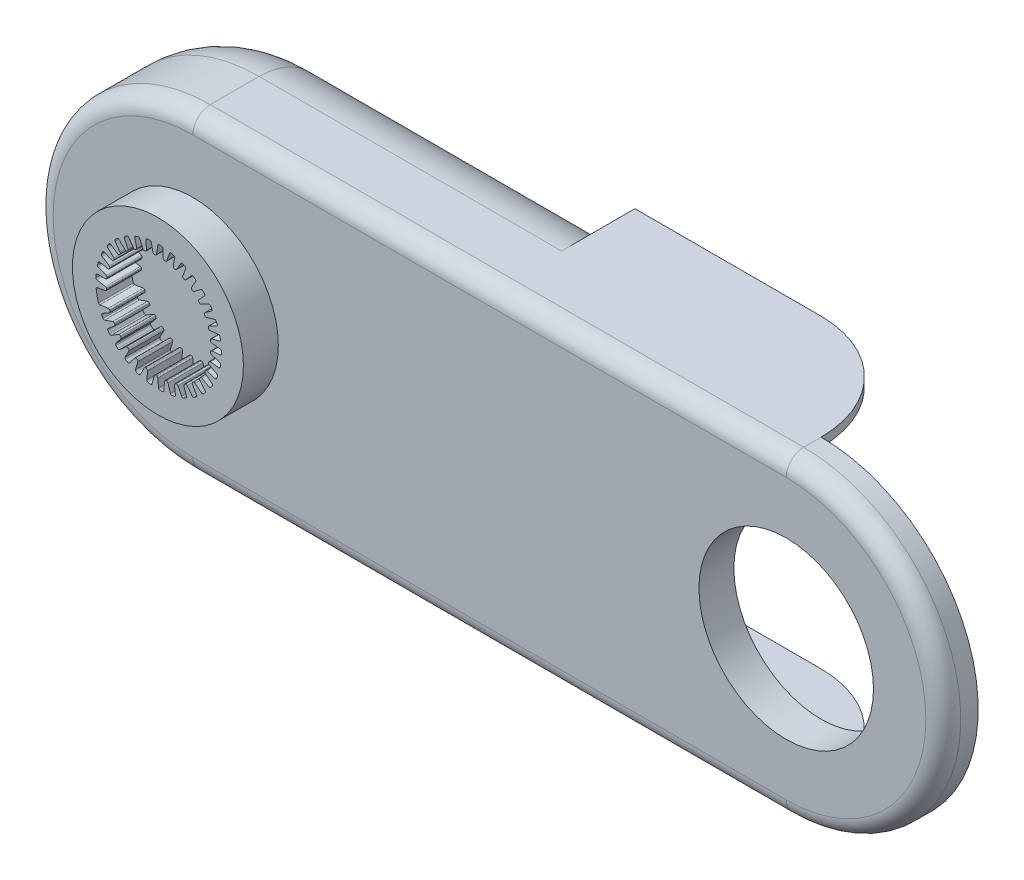
from build123d import *

# Parameters (mm, degrees)
SKETCH1_R           = 24.5
BOSS_EXTRUDE1_DEPTH = 10
BOSS_EXTRUDE3_DEPTH = 40
CUT_EXTRUDE3_DEPTH  = 30
FILLET12_R          = 5
FILLET14_R          = 30
SKETCH8_W           = 148.27581146
SKETCH8_H           = 90
CUT_EXTRUDE4_DEPTH  = 1
FILLET16_R          = 20
SKETCH9_R           = 25
CUT_EXTRUDE5_DEPTH  = 222.337274565
SCALE1_SCALE        = 0.3


with BuildPart() as part:
    # Sketch1 → Boss-Extrude1 (new body)
    with BuildSketch(Plane.XY):
        with Locations((-0.371975008, 0)):
            Circle(SKETCH1_R)
        with BuildLine():
            Line((-16.969142825, -5.497864624), (-14.564977721, -5.124585631))
            ThreePointArc((-14.564977721, -5.124585631), (-14.29707046, -5.177296982), (-14.125400218, -5.389622476))
            Line((-14.125400218, -5.389622476), (-14.049847687, -5.60904296))
            ThreePointArc((-14.049847687, -5.60904296), (-14.054138659, -5.881349365), (-14.231761388, -6.087793926))
            Line((-14.231761388, -6.087793926), (-16.278130424, -7.240339372))
            ThreePointArc((-16.278130424, -7.240339372), (-16.462911631, -7.467282264), (-16.443705401, -7.759306734))
            ThreePointArc((-16.443705401, -7.759306734), (-16.284490349, -8.088614134), (-16.11861668, -8.414618309))
            ThreePointArc((-16.11861668, -8.414618309), (-15.909353928, -8.602256969), (-15.62830969, -8.605904202))
            Line((-15.62830969, -8.605904202), (-13.33954086, -7.780747067))
            ThreePointArc((-13.33954086, -7.780747067), (-13.06649801, -7.781370848), (-12.857468219, -7.957039097))
            Line((-12.857468219, -7.957039097), (-12.741436398, -8.158012106))
            ThreePointArc((-12.741436398, -8.158012106), (-12.693690022, -8.426134232), (-12.828657842, -8.662677839))
            Line((-12.828657842, -8.662677839), (-14.617513276, -10.1845134))
            ThreePointArc((-14.617513276, -10.1845134), (-14.755596786, -10.442544627), (-14.681022533, -10.725539064))
            ThreePointArc((-14.681022533, -10.725539064), (-14.461897897, -11.018416496), (-14.236867265, -11.306780868))
            ThreePointArc((-14.236867265, -11.306780868), (-13.995646114, -11.451042861), (-13.719069526, -11.400997316))
            Line((-13.719069526, -11.400997316), (-11.62979923, -10.15428296))
            ThreePointArc((-11.62979923, -10.15428296), (-11.361653923, -10.102796248), (-11.122945516, -10.235352213))
            Line((-11.122945516, -10.235352213), (-10.970698069, -10.410492867))
            ThreePointArc((-10.970698069, -10.410492867), (-10.872668815, -10.664578395), (-10.960022248, -10.922529105))
            Line((-10.960022248, -10.922529105), (-12.425631454, -12.757733968))
            ThreePointArc((-12.425631454, -12.757733968), (-12.511943302, -13.037372011), (-12.384741304, -13.300937604))
            ThreePointArc((-12.384741304, -13.300937604), (-12.113758956, -13.546623101), (-11.837840254, -13.786751538))
            ThreePointArc((-11.837840254, -13.786751538), (-11.57352453, -13.882335867), (-11.311578572, -13.780436499))
            Line((-11.311578572, -13.780436499), (-9.49857837, -12.157976231))
            ThreePointArc((-9.49857837, -12.157976231), (-9.245183775, -12.056270938), (-8.985568244, -12.140843765))
            Line((-8.985568244, -12.140843765), (-8.802699599, -12.28371641))
            ThreePointArc((-8.802699599, -12.28371641), (-8.657989614, -12.514428808), (-8.694518802, -12.784308057))
            Line((-8.694518802, -12.784308057), (-9.783027044, -14.865446458))
            ThreePointArc((-9.783027044, -14.865446458), (-9.814395646, -15.15641584), (-9.63924002, -15.390867705))
            ThreePointArc((-9.63924002, -15.390867705), (-9.326357378, -15.580333398), (-9.009689414, -15.763402229))
            ThreePointArc((-9.009689414, -15.763402229), (-8.731991565, -15.806796587), (-8.494301608, -15.656787752))
            Line((-8.494301608, -15.656787752), (-7.02419134, -13.718199902))
            ThreePointArc((-7.02419134, -13.718199902), (-6.794858602, -13.570013254), (-6.523875683, -13.603495261))
            Line((-6.523875683, -13.603495261), (-6.317105464, -13.70884995))
            ThreePointArc((-6.317105464, -13.70884995), (-6.131032208, -13.907711545), (-6.115394864, -14.179602449))
            Line((-6.115394864, -14.179602449), (-6.786804216, -16.430201641))
            ThreePointArc((-6.786804216, -16.430201641), (-6.762076913, -16.721810507), (-6.545403865, -16.918533562))
            ThreePointArc((-6.545403865, -16.918533562), (-6.202118, -17.044817414), (-5.856336939, -17.164099659))
            ThreePointArc((-5.856336939, -17.164099659), (-5.575461147, -17.153709492), (-5.370761259, -16.96110336))
            Line((-5.370761259, -16.96110336), (-4.297561057, -14.777622566))
            ThreePointArc((-4.297561057, -14.777622566), (-4.100717154, -14.588399775), (-3.828324286, -14.569560645))
            Line((-3.828324286, -14.569560645), (-3.605250396, -14.633526053))
            ThreePointArc((-3.605250396, -14.633526053), (-3.384651249, -14.79322955), (-3.317421976, -15.057141307))
            Line((-3.317421976, -15.057141307), (-3.547061077, -17.394501596))
            ThreePointArc((-3.547061077, -17.394501596), (-3.467146489, -17.676034594), (-3.216917807, -17.827800126))
            ThreePointArc((-3.216917807, -17.827800126), (-2.855842975, -17.886261756), (-2.49365476, -17.937374314))
            ThreePointArc((-2.49365476, -17.937374314), (-2.219921985, -17.873581416), (-2.055733994, -17.645455421))
            Line((-2.055733994, -17.645455421), (-1.418879279, -15.297315067))
            ThreePointArc((-1.418879279, -15.297315067), (-1.261757363, -15.074009244), (-0.997963795, -15.003541232))
            Line((-0.997963795, -15.003541232), (-0.766783225, -15.023766911))
            ThreePointArc((-0.766783225, -15.023766911), (-0.519764242, -15.138443903), (-0.403413423, -15.384678908))
            Line((-0.403413423, -15.384678908), (-0.182844038, -17.722912511))
            ThreePointArc((-0.182844038, -17.722912511), (-0.050678678, -17.984024533), (0.223910828, -18.085255821))
            ThreePointArc((0.223910828, -18.085255821), (0.589506703, -18.073747021), (0.954793236, -18.054811727))
            ThreePointArc((0.954793236, -18.054811727), (1.21132451, -17.939960209), (1.328967414, -17.684696986))
            Line((1.328967414, -17.684696986), (1.506075012, -15.258180974))
            ThreePointArc((1.506075012, -15.258180974), (1.617701396, -15.008997633), (1.863202402, -14.889490132))
            Line((1.863202402, -14.889490132), (2.093994776, -14.865232876))
            ThreePointArc((2.093994776, -14.865232876), (2.358356726, -14.930669484), (2.519553706, -15.150179676))
            Line((2.519553706, -15.150179676), (3.182226615, -17.403366719))
            ThreePointArc((3.182226615, -17.403366719), (3.361786248, -17.634463038), (3.650646611, -17.681440275))
            ThreePointArc((3.650646611, -17.681440275), (4.007329478, -17.600383942), (4.362291644, -17.512096587))
            ThreePointArc((4.362291644, -17.512096587), (4.592195013, -17.35040674), (4.658969966, -17.077386096))
            Line((4.658969966, -17.077386096), (4.369822517, -14.661658296))
            ThreePointArc((4.369822517, -14.661658296), (4.431851587, -14.395753836), (4.650038942, -14.231598224))
            Line((4.650038942, -14.231598224), (4.871962507, -14.163749381))
            ThreePointArc((4.871962507, -14.163749381), (5.143953277, -14.177541097), (5.344073133, -14.362260434))
            Line((5.344073133, -14.362260434), (6.424499231, -16.447606133))
            ThreePointArc((6.424499231, -16.447606133), (6.644855104, -16.640194968), (6.937371968, -16.631191945))
            ThreePointArc((6.937371968, -16.631191945), (7.272035289, -16.483566546), (7.603629778, -16.329171304))
            ThreePointArc((7.603629778, -16.329171304), (7.798457298, -16.126584524), (7.811910612, -15.845838777))
            Line((7.811910612, -15.845838777), (7.067133021, -13.529666635))
            ThreePointArc((7.067133021, -13.529666635), (7.077285479, -13.256811885), (7.260141751, -13.054040163))
            Line((7.260141751, -13.054040163), (7.465041785, -12.945092882))
            ThreePointArc((7.465041785, -12.945092882), (7.734666902, -12.906732919), (7.966356105, -13.049873773))
            Line((7.966356105, -13.049873773), (9.42483445, -14.89075078))
            ThreePointArc((9.42483445, -14.89075078), (9.677889447, -15.037755333), (9.963314095, -14.973102872))
            ThreePointArc((9.963314095, -14.973102872), (10.263660453, -14.764332996), (10.559702617, -14.549503217))
            ThreePointArc((10.559702617, -14.549503217), (10.712295226, -14.313463684), (10.671932552, -14.035309014))
            Line((10.671932552, -14.035309014), (9.498892143, -11.903801741))
            ThreePointArc((9.498892143, -11.903801741), (9.456794931, -11.634022921), (9.597600949, -11.400086065))
            Line((9.597600949, -11.400086065), (9.777948272, -11.254043683))
            ThreePointArc((9.777948272, -11.254043683), (10.03530019, -11.164941603), (10.290045172, -11.261244173))
            Line((10.290045172, -11.261244173), (12.072983054, -12.790008296))
            ThreePointArc((12.072983054, -12.790008296), (12.349438509, -12.886026792), (12.617282831, -12.768100588))
            ThreePointArc((12.617282831, -12.768100588), (12.872275811, -12.505857615), (13.121887392, -12.238487357))
            ThreePointArc((13.121887392, -12.238487357), (13.226637979, -11.977668492), (13.133942467, -11.712325868))
            Line((13.133942467, -11.712325868), (11.575743353, -9.84380705))
            ThreePointArc((11.575743353, -9.84380705), (11.48294336, -9.587017353), (11.576525119, -9.330511522))
            Line((11.576525119, -9.330511522), (11.725692753, -9.152740458))
            ThreePointArc((11.725692753, -9.152740458), (11.961314913, -9.016170373), (12.229754908, -9.062095959))
            Line((12.229754908, -9.062095959), (14.271637147, -10.222571794))
            ThreePointArc((14.271637147, -10.222571794), (14.561334529, -10.264075972), (14.801756416, -10.097209299))
            ThreePointArc((14.801756416, -10.097209299), (15.002026138, -9.791129513), (15.196035002, -9.481043465))
            ThreePointArc((15.196035002, -9.481043465), (15.24909444, -9.205029223), (15.107472246, -8.962248828))
            Line((15.107472246, -8.962248828), (13.22137144, -7.42537837))
            ThreePointArc((13.22137144, -7.42537837), (13.08127866, -7.191013697), (13.124197438, -6.921364359))
            Line((13.124197438, -6.921364359), (13.236704125, -6.718396924))
            ThreePointArc((13.236704125, -6.718396924), (13.441938441, -6.539377188), (13.714209453, -6.533238226))
            Line((13.714209453, -6.533238226), (15.940005792, -7.282783352))
            ThreePointArc((15.940005792, -7.282783352), (16.232299988, -7.268248115), (16.436464985, -7.058572594))
            ThreePointArc((16.436464985, -7.058572594), (16.574652412, -6.719903092), (16.705929579, -6.378495562))
            ThreePointArc((16.705929579, -6.378495562), (16.705348165, -6.09742826), (16.520003287, -5.886131214))
            Line((16.520003287, -5.886131214), (14.375306757, -4.737382395))
            ThreePointArc((14.375306757, -4.737382395), (14.193068988, -4.534054623), (14.183747708, -4.261170214))
            Line((14.183747708, -4.261170214), (14.255459317, -4.040464575))
            ThreePointArc((14.255459317, -4.040464575), (14.422764326, -3.825573383), (14.688861583, -3.767595452))
            Line((14.688861583, -3.767595452), (17.016783726, -4.07866736))
            ThreePointArc((17.016783726, -4.07866736), (17.300934201, -4.008626814), (17.461340136, -3.763847105))
            ThreePointArc((17.461340136, -3.763847105), (17.532367484, -3.405032512), (17.596089091, -3.044848735))
            ThreePointArc((17.596089091, -3.044848735), (17.54188819, -2.76905637), (17.319631242, -2.597006915))
            Line((17.319631242, -2.597006915), (14.99514722, -1.878591239))
            ThreePointArc((14.99514722, -1.878591239), (14.777460905, -1.713771776), (14.716242083, -1.447679606))
            Line((14.716242083, -1.447679606), (14.744523527, -1.217345731))
            ThreePointArc((14.744523527, -1.217345731), (14.867751498, -0.974479394), (15.117897089, -0.866792932))
            Line((15.117897089, -0.866792932), (17.462404064, -0.727961087))
            ThreePointArc((17.462404064, -0.727961087), (17.727969528, -0.604988917), (17.838722184, -0.334099605))
            ThreePointArc((17.838722184, -0.334099605), (17.839979507, 0.031675211), (17.833804064, 0.397400053))
            ThreePointArc((17.833804064, 0.397400053), (17.727975323, 0.657783316), (17.476973277, 0.784263113))
            Line((17.476973277, 0.784263113), (15.0581164, 1.045947009))
            ThreePointArc((15.0581164, 1.045947009), (14.812980559, 1.166201766), (14.70211372, 1.415723972))
            Line((14.70211372, 1.415723972), (14.685925779, 1.647222319))
            ThreePointArc((14.685925779, 1.647222319), (14.760548624, 1.909139522), (14.985550789, 2.06257751))
            Line((14.985550789, 2.06257751), (17.260492203, 2.646211643))
            ThreePointArc((17.260492203, 2.646211643), (17.497714285, 2.817596748), (17.554743986, 3.104641663))
            ThreePointArc((17.554743986, 3.104641663), (17.486185083, 3.463936074), (17.410339511, 3.821763191))
            ThreePointArc((17.410339511, 3.821763191), (17.256771672, 4.057169404), (16.986247758, 4.133431962))
            Line((16.986247758, 4.133431962), (14.561900453, 3.928768337))
            ThreePointArc((14.561900453, 3.928768337), (14.298322759, 4.000039553), (14.141881775, 4.223822943))
            Line((14.141881775, 4.223822943), (14.081819284, 4.447979208))
            ThreePointArc((14.081819284, 4.447979208), (14.105094939, 4.719322965), (14.296685833, 4.912874302))
            Line((14.296685833, 4.912874302), (16.418467522, 5.919864718))
            ThreePointArc((16.418467522, 5.919864718), (16.618629347, 6.133365102), (16.6198405, 6.426017974))
            ThreePointArc((16.6198405, 6.426017974), (16.483984611, 6.765629479), (16.341255904, 7.102410286))
            ThreePointArc((16.341255904, 7.102410286), (16.145591916, 7.304189299), (15.865486706, 7.327432303))
            Line((15.865486706, 7.327432303), (13.52473315, 6.663941652))
            ThreePointArc((13.52473315, 6.663941652), (13.252398931, 6.68361042), (13.056132325, 6.873431931))
            Line((13.056132325, 6.873431931), (12.95440232, 7.082009351))
            ThreePointArc((12.95440232, 7.082009351), (12.925475505, 7.352808963), (13.076614998, 7.579361483))
            Line((13.076614998, 7.579361483), (14.967270753, 8.972705682))
            ThreePointArc((14.967270753, 8.972705682), (15.123017247, 9.220476139), (15.068365347, 9.507983253))
            ThreePointArc((15.068365347, 9.507983253), (14.870204584, 9.815432612), (14.665837397, 10.118791886))
            ThreePointArc((14.665837397, 10.118791886), (14.435267057, 10.279529201), (14.155873194, 10.248898572))
            Line((14.155873194, 10.248898572), (11.984725859, 9.150961278))
            ThreePointArc((11.984725859, 9.150961278), (11.713642209, 9.118304857), (11.484761921, 9.267189378))
            Line((11.484761921, 9.267189378), (11.345102535, 9.452523643))
            ThreePointArc((11.345102535, 9.452523643), (11.265036185, 9.712828408), (11.370170562, 9.964057294))
            Line((11.370170562, 9.964057294), (12.960227038, 11.692555961))
            ThreePointArc((12.960227038, 11.692555961), (13.065835198, 11.965492009), (12.957328464, 12.237288733))
            ThreePointArc((12.957328464, 12.237288733), (12.704144369, 12.501278525), (12.445648304, 12.760069138))
            ThreePointArc((12.445648304, 12.760069138), (12.188644066, 12.87385836), (11.920228055, 12.79047964))
            Line((11.920228055, 12.79047964), (9.998467123, 11.298440105))
            ThreePointArc((9.998467123, 11.298440105), (9.738595182, 11.214658475), (9.485511563, 11.317135151))
            Line((9.485511563, 11.317135151), (9.313054669, 11.472416036))
            ThreePointArc((9.313054669, 11.472416036), (9.184790873, 11.712660889), (9.240056903, 11.979334578))
            Line((9.240056903, 11.979334578), (10.47108647, 13.979472934))
            ThreePointArc((10.47108647, 13.979472934), (10.522675657, 14.267545366), (10.364301238, 14.513644357))
            ThreePointArc((10.364301238, 14.513644357), (10.065397221, 14.724474111), (9.76227088, 14.929186636))
            ThreePointArc((9.76227088, 14.929186636), (9.488276526, 14.99184651), (9.240701483, 14.858783502))
            Line((9.240701483, 14.858783502), (7.638943277, 13.027467663))
            ThreePointArc((7.638943277, 13.027467663), (7.399832204, 12.895639434), (7.131844973, 12.947942693))
            Line((7.131844973, 12.947942693), (6.932927607, 13.067464305))
            ThreePointArc((6.932927607, 13.067464305), (6.7611795, 13.278821297), (6.764546399, 13.551140695))
            Line((6.764546399, 13.551140695), (7.591314094, 15.749422391))
            ThreePointArc((7.591314094, 15.749422391), (7.586988632, 16.042045802), (7.384566095, 16.253403998))
            ThreePointArc((7.384566095, 16.253403998), (7.050925573, 16.40332664), (6.714307526, 16.546438787))
            ThreePointArc((6.714307526, 16.546438787), (6.433391152, 16.555666835), (6.215754379, 16.377809024))
            Line((6.215754379, 16.377809024), (4.992856518, 14.274509741))
            ThreePointArc((4.992856518, 14.274509741), (4.783292601, 14.099479023), (4.510249118, 14.09968695))
            Line((4.510249118, 14.09968695), (4.292180626, 14.17905739))
            ThreePointArc((4.292180626, 14.17905739), (4.0832592, 14.353760076), (4.034603248, 14.621718634))
            Line((4.034603248, 14.621718634), (4.426728971, 16.937366417))
            ThreePointArc((4.426728971, 16.937366417), (4.3666478, 17.223788175), (4.127615291, 17.392639084))
            ThreePointArc((4.127615291, 17.392639084), (3.771498096, 17.476145612), (3.413757585, 17.552398635))
            ThreePointArc((3.413757585, 17.552398635), (3.136241642, 17.507855766), (2.956540339, 17.29173865))
            Line((2.956540339, 17.29173865), (2.15743898, 14.993742987))
            ThreePointArc((2.15743898, 14.993742987), (1.985122778, 14.781941396), (1.717056198, 14.73004635))
            Line((1.717056198, 14.73004635), (1.487849644, 14.766349102))
            ThreePointArc((1.487849644, 14.766349102), (1.249431849, 14.897977919), (1.150540941, 15.151729331))
            Line((1.150540941, 15.151729331), (1.093615783, 17.499653257))
            ThreePointArc((1.093615783, 17.499653257), (0.979986625, 17.769348613), (0.713127543, 17.889487702))
            ThreePointArc((0.713127543, 17.889487702), (0.347619428, 17.903509616), (-0.018098145, 17.910101548))
            ThreePointArc((-0.018098145, 17.910101548), (-0.282016159, 17.81342452), (-0.417178752, 17.566989459))
            Line((-0.417178752, 17.566989459), (-0.763120125, 15.15873872))
            ThreePointArc((-0.763120125, 15.15873872), (-0.891856745, 14.91794904), (-1.145096145, 14.815857937))
            Line((-1.145096145, 14.815857937), (-1.37701842, 14.807759033))
            ThreePointArc((-1.37701842, 14.807759033), (-1.636171771, 14.891477199), (-1.781663826, 15.121697207))
            Line((-1.781663826, 15.121697207), (-2.285548115, 17.415621326))
            ThreePointArc((-2.285548115, 17.415621326), (-2.448549885, 17.658680152), (-2.733429633, 17.725692835))
            ThreePointArc((-2.733429633, 17.725692835), (-3.094897842, 17.669714891), (-3.455153952, 17.606403508))
            ThreePointArc((-3.455153952, 17.606403508), (-3.695776202, 17.461144777), (-3.781433452, 17.193447184))
            Line((-3.781433452, 17.193447184), (-3.661503004, 14.763434069))
            ThreePointArc((-3.661503004, 14.763434069), (-3.741929532, 14.502504268), (-3.97103631, 14.353968511))
            Line((-3.97103631, 14.353968511), (-4.197152176, 14.30176555))
            ThreePointArc((-4.197152176, 14.30176555), (-4.467518329, 14.334496787), (-4.654265334, 14.532725812))
            Line((-4.654265334, 14.532725812), (-5.586593206, 16.688358429))
            ThreePointArc((-5.586593206, 16.688358429), (-5.792977985, 16.895849376), (-6.085410312, 16.907273229))
            ThreePointArc((-6.085410312, 16.907273229), (-6.429556237, 16.783352371), (-6.771113046, 16.65246409))
            ThreePointArc((-6.771113046, 16.65246409), (-6.979597716, 16.463961282), (-7.012602092, 16.184837873))
            Line((-7.012602092, 16.184837873), (-6.431206742, 13.822354752))
            ThreePointArc((-6.431206742, 13.822354752), (-6.460367855, 13.550872862), (-6.656923338, 13.36135049))
            Line((-6.656923338, 13.36135049), (-6.868924024, 13.266961704))
            ThreePointArc((-6.868924024, 13.266961704), (-7.140568204, 13.247503281), (-7.361708022, 13.406457273))
            Line((-7.361708022, 13.406457273), (-8.688220498, 15.344588302))
            ThreePointArc((-8.688220498, 15.344588302), (-8.930404547, 15.508886984), (-9.219643842, 15.46430223))
            ThreePointArc((-9.219643842, 15.46430223), (-9.533821622, 15.276992009), (-9.84412841, 15.083336403))
            ThreePointArc((-9.84412841, 15.083336403), (-10.012814597, 14.858516172), (-9.991953333, 14.578223515))
            Line((-9.991953333, 14.578223515), (-8.970456822, 12.370081325))
            ThreePointArc((-8.970456822, 12.370081325), (-8.947280977, 12.098023119), (-9.104062609, 11.874478253))
            Line((-9.104062609, 11.874478253), (-9.294158016, 11.741372016))
            ThreePointArc((-9.294158016, 11.741372016), (-9.557098485, 11.670438947), (-9.804505193, 11.784277039))
            Line((-9.804505193, 11.784277039), (-11.476458734, 13.43368863))
            ThreePointArc((-11.476458734, 13.43368863), (-11.745542845, 13.548757787), (-12.020960828, 13.449802721))
            ThreePointArc((-12.020960828, 13.449802721), (-12.293625803, 13.20598597), (-12.561280149, 12.956679036))
            ThreePointArc((-12.561280149, 12.956679036), (-12.683969373, 12.703802544), (-12.610009029, 12.43264017))
            Line((-12.610009029, 12.43264017), (-11.185946893, 10.459978494))
            ThreePointArc((-11.185946893, 10.459978494), (-11.1112857, 10.197340923), (-11.222532441, 9.947987861))
            Line((-11.222532441, 9.947987861), (-11.383737393, 9.781055247))
            ThreePointArc((-11.383737393, 9.781055247), (-11.628312237, 9.661254011), (-11.892894719, 9.725793152))
            Line((-11.892894719, 9.725793152), (-13.848852332, 11.02587663))
            ThreePointArc((-13.848852332, 11.02587663), (-14.134948842, 11.087487974), (-14.386425104, 10.937798763))
            ThreePointArc((-14.386425104, 10.937798763), (-14.607558025, 10.646434682), (-14.822724802, 10.350637362))
            ThreePointArc((-14.822724802, 10.350637362), (-14.89490877, 10.078996716), (-14.770567065, 9.826928657))
            Line((-14.770567065, 9.826928657), (-12.996267369, 8.162234197))
            ThreePointArc((-12.996267369, 8.162234197), (-12.872864302, 7.918668046), (-12.934488319, 7.652669423))
            Line((-12.934488319, 7.652669423), (-13.060879237, 7.458044476))
            ThreePointArc((-13.060879237, 7.458044476), (-13.278101399, 7.293777246), (-13.550137405, 7.306645904))
            Line((-13.550137405, 7.306645904), (-15.71822619, 8.209628879))
            ThreePointArc((-15.71822619, 8.209628879), (-16.010822299, 8.215518462), (-16.229116186, 8.02059553))
            ThreePointArc((-16.229116186, 8.02059553), (-16.390591385, 7.692390478), (-16.545364153, 7.360972031))
            ThreePointArc((-16.545364153, 7.360972031), (-16.56439042, 7.080548838), (-16.394236369, 6.856837495))
            Line((-16.394236369, 6.856837495), (-14.334896879, 5.561280504))
            ThreePointArc((-14.334896879, 5.561280504), (-14.16728646, 5.345735764), (-14.177023341, 5.072865868))
            Line((-14.177023341, 5.072865868), (-14.263955911, 4.857700206))
            ThreePointArc((-14.263955911, 4.857700206), (-14.445843425, 4.655003085), (-14.715336818, 4.615728392))
            Line((-14.715336818, 4.615728392), (-17.015888981, 5.088430184))
            ThreePointArc((-17.015888981, 5.088430184), (-17.304233061, 5.038381589), (-17.481323225, 4.805387503))
            ThreePointArc((-17.481323225, 4.805387503), (-17.577207194, 4.452401581), (-17.665898729, 4.097540189))
            ThreePointArc((-17.665898729, 4.097540189), (-17.631068162, 3.818638777), (-17.421354184, 3.631504565))
            Line((-17.421354184, 3.631504565), (-15.152646632, 2.752691104))
            ThreePointArc((-15.152646632, 2.752691104), (-14.946987814, 2.573088104), (-14.90447977, 2.303373712))
            Line((-14.90447977, 2.303373712), (-14.9487596, 2.075573732))
            ThreePointArc((-14.9487596, 2.075573732), (-15.088628894, 1.841894954), (-15.34567697, 1.751920085))
            Line((-15.34567697, 1.751920085), (-17.694157264, 1.776970967))
            ThreePointArc((-17.694157264, 1.776970967), (-17.967653929, 1.672823261), (-18.09703308, 1.410319536))
            ThreePointArc((-18.09703308, 1.410319536), (-18.123802502, 1.045523436), (-18.143153778, 0.680258704))
            ThreePointArc((-18.143153778, 0.680258704), (-18.055746248, 0.413127482), (-17.814178415, 0.269446766))
            Line((-17.814178415, 0.269446766), (-15.419467897, -0.160330607))
            ThreePointArc((-15.419467897, -0.160330607), (-15.183317743, -0.297392242), (-15.090126759, -0.554040304))
            Line((-15.090126759, -0.554040304), (-15.090126759, -0.786103946))
            ThreePointArc((-15.090126759, -0.786103946), (-15.182838247, -1.042177706), (-15.417995612, -1.179546569))
            Line((-15.417995612, -1.179546569), (-17.728107642, -1.603067108))
            ThreePointArc((-17.728107642, -1.603067108), (-17.976707083, -1.757486951), (-18.053621104, -2.039854449))
            ThreePointArc((-18.053621104, -2.039854449), (-17.805412438, -3.642620368), (-17.413942426, -5.216538207))
            ThreePointArc((-17.413942426, -5.216538207), (-17.244327564, -5.440658632), (-16.969142825, -5.497864624))
        make_face(mode=Mode.SUBTRACT)
    extrude(amount=BOSS_EXTRUDE1_DEPTH)

    # Sketch6 → Boss-Extrude3 (add)
    with BuildSketch(Plane.XY):
        with BuildLine():
            Line((-0.371975008, 45), (169.628024992, 45))
            ThreePointArc((169.628024992, 45), (214.628024992, 0), (169.628024992, -45))
            Line((169.628024992, -45), (-0.371975008, -45))
            ThreePointArc((-0.371975008, -45), (-45.371975008, 0), (-0.371975008, 45))
        make_face()
    extrude(amount=-BOSS_EXTRUDE3_DEPTH)

    # Sketch7 → Cut-Extrude3 (cut)
    with BuildSketch(Plane(origin=(0, 0, -40), x_dir=(-1, 0, 0), z_dir=(0, 0, -1))):
        Polygon((-169.628024992, 42.5), (-91.437307777, 42.5), (-91.437307777, -42.5), (-169.628024992, -42.5), (-169.628024992, -45), (-257.061182099, -45), (-257.061182099, -42.5), (-257.061182099, 42.5), (-257.061182099, 45), (-169.628024992, 45), align=None)
    extrude(amount=-CUT_EXTRUDE3_DEPTH, mode=Mode.SUBTRACT)

    # Fillet12
    fillet12_edges = [part.edges().sort_by_distance(p)[0] for p in [
        (-45.371975008, 0, 0),
        (84.628024992, -45, 0),
        (214.628024992, 0, 0),
        (84.628024992, 45, 0),
    ]]
    fillet(fillet12_edges, radius=FILLET12_R)

    # Fillet14
    fillet14_edges = [part.edges().sort_by_distance(p)[0] for p in [
        (169.628024992, -43.75, -40),
        (169.628024992, 43.75, -40),
    ]]
    fillet(fillet14_edges, radius=FILLET14_R - 0.0001)  # a hair under: the kernel refuses the full size

    # Sketch8 → Cut-Extrude4 (cut)
    with BuildSketch(Plane(origin=(0, 0, -40), x_dir=(-1, 0, 0), z_dir=(0, 0, -1))):
        with Locations((-12.137628278, 0)):
            Rectangle(SKETCH8_W, SKETCH8_H)
    extrude(amount=-CUT_EXTRUDE4_DEPTH, mode=Mode.SUBTRACT)

    # Fillet16
    fillet16_edges = [part.edges().sort_by_distance(p)[0] for p in [
        (42.9517795, -45, -39),
        (42.9517795, 45, -39),
        (-45.371975008, 0, -39),
    ]]
    fillet(fillet16_edges, radius=FILLET16_R)

    # Sketch9 → Cut-Extrude5 (cut, through all)
    with BuildSketch(Plane(origin=(0, 0, -10), x_dir=(-1, 0, 0), z_dir=(0, 0, -1))):
        with Locations((-169.628024992, 0)):
            Circle(SKETCH9_R)
    extrude(amount=-CUT_EXTRUDE5_DEPTH, mode=Mode.SUBTRACT)


with BuildPart() as part_1:
    # Scale1: scaled about (47.778241752, 0.001707801, -16.220408495)
    add(part.part.scale(SCALE1_SCALE).moved(Location((33.444769226, 0.001195461, -11.354285946))))


solid = part_1.part
